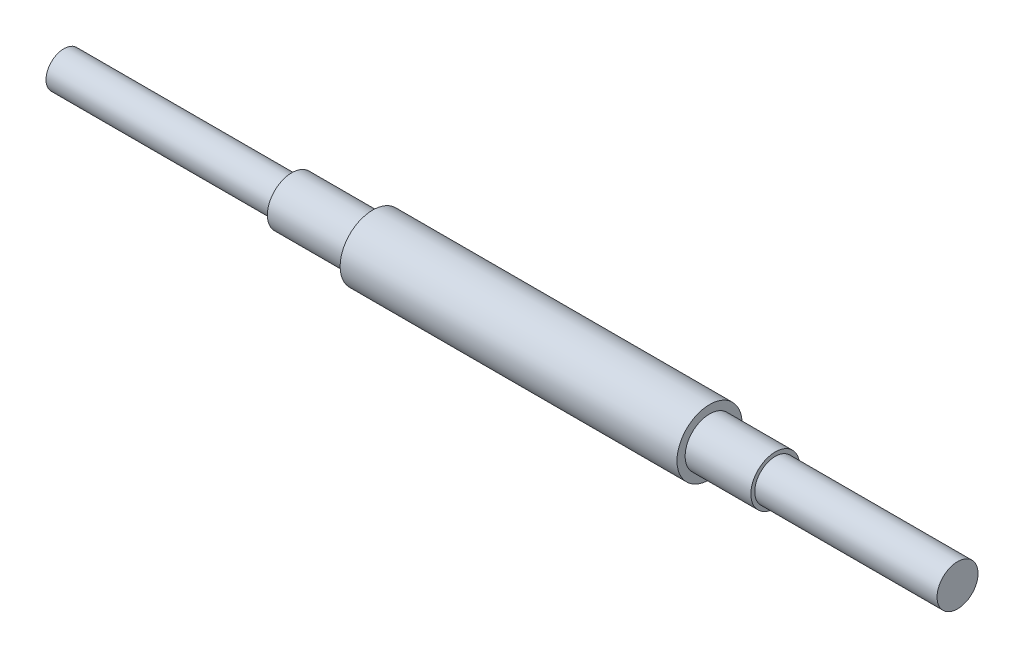
from build123d import *


with BuildPart() as part:
    # Sketch1 → Revolve1 (revolve)
    with BuildSketch(Plane(origin=(0, 0, 0), x_dir=(1, 0, 0), z_dir=(0, 1, 0))):
        Polygon((-78.63058905, 0), (-78.63058905, 3.499993), (-34.18058905, 3.499993), (-34.18058905, 4.7625), (-18.39834985, 4.7625), (-18.39834985, 6.35), (47.32161015, 6.35), (47.32161015, 4.7625), (60.14297135, 4.7625), (60.14297135, 3.99923), (95.70297135, 3.99923), (95.70297135, 0), align=None)
    revolve(axis=Axis((-97.950567047, 0, 0), (1, 0, 0)))


solid = part.part
